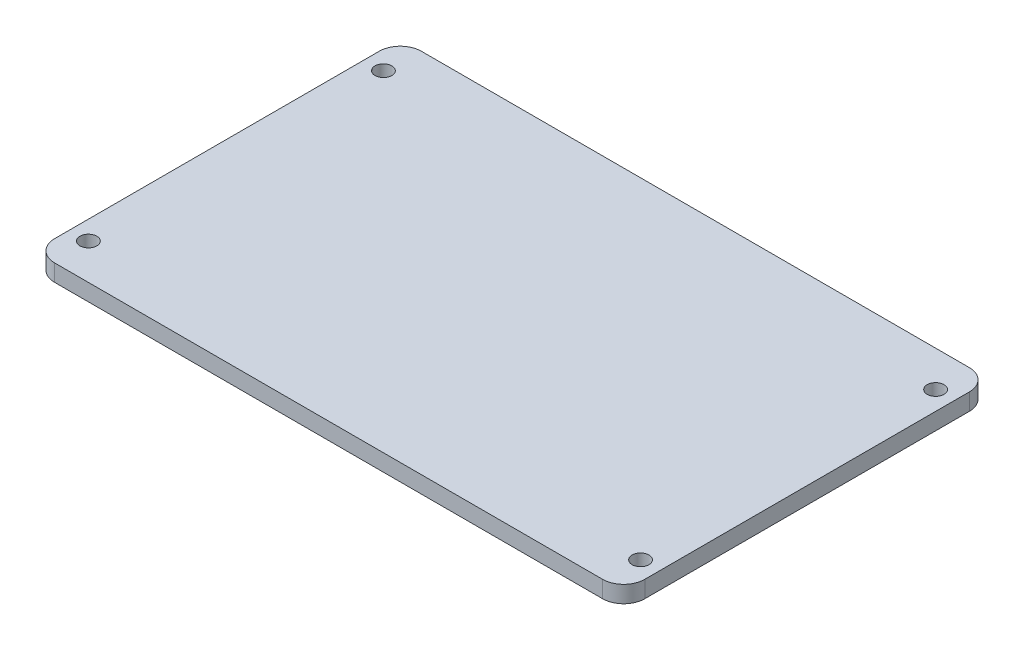
from build123d import *

# Parameters (mm, degrees)
SKETCH1_W               = 140
SKETCH1_H               = 87
BOSS_EXTRUDE1_DEPTH     = 4
BOSS_EXTRUDE2_START     = -4
BOSS_EXTRUDE2_OUTLINE_R = 2
BOSS_EXTRUDE2_DEPTH     = 4
FILLET1_R               = 5


# Read off the part's stored shape, not the designer's step: Boss-Extrude2
with BuildPart() as part:
    # Sketch1 → Boss-Extrude1 (new body)
    with BuildSketch(Plane(origin=(0, 0, 0), x_dir=(1, 0, 0), z_dir=(0, 1, 0))):
        Rectangle(SKETCH1_W, SKETCH1_H)
    extrude(amount=BOSS_EXTRUDE1_DEPTH)

    # Boss-Extrude2 outline → Boss-Extrude2 (cut)
    with BuildSketch(Plane(origin=(0, 4, 0), x_dir=(1, 0, 0), z_dir=(0, 1, 0)).offset(BOSS_EXTRUDE2_START)):
        with Locations((-65.5, 35)):
            Circle(BOSS_EXTRUDE2_OUTLINE_R)
        with Locations((65.5, -35)):
            Circle(BOSS_EXTRUDE2_OUTLINE_R)
        with Locations((-65.5, -35)):
            Circle(BOSS_EXTRUDE2_OUTLINE_R)
        with Locations((65.5, 35)):
            Circle(BOSS_EXTRUDE2_OUTLINE_R)
    extrude(amount=BOSS_EXTRUDE2_DEPTH, mode=Mode.SUBTRACT)

    # Fillet1
    fillet1_edges = [part.edges().sort_by_distance(p)[0] for p in [
        (70, 2, 43.5),
        (-70, 2, 43.5),
        (-70, 2, -43.5),
        (70, 2, -43.5),
    ]]
    fillet(fillet1_edges, radius=FILLET1_R)


solid = part.part
